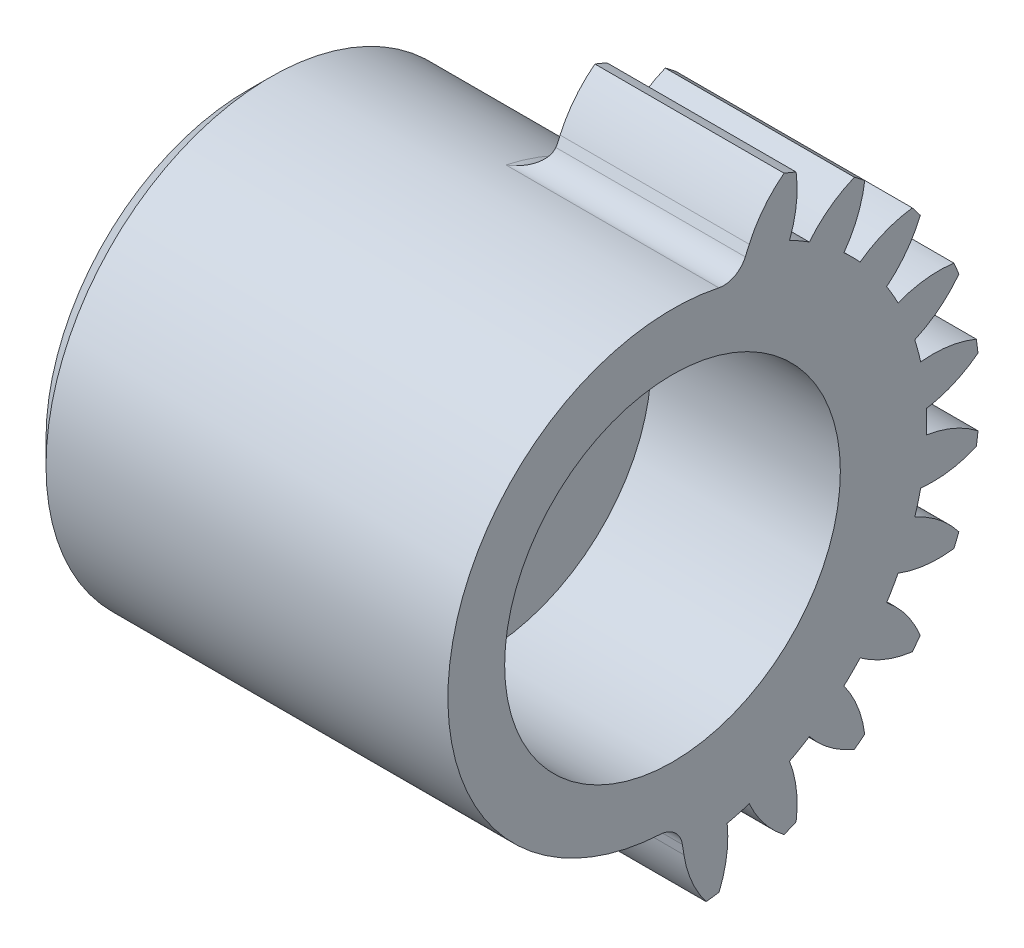
from build123d import *

# Parameters (mm, degrees)
BASPROSKE_W         = 8
BASPROSKE_H         = 13
TOOTHCUT_DEPTH      = 21.049937656
TEETHCUTS_COUNT     = 24
TEETHCUTS_ANGLE     = 345
BORSKE_R            = 2.5
BORE_DEPTH          = 50.0000508
SKETCH2_R           = 9.5
SKETCH2_R_2         = 7.1
SKETCH2_R_3         = 2.5
BOSS_EXTRUDE1_DEPTH = 10
CUT_EXTRUDE1_DEPTH  = 10
SKETCH2_4_R         = 7.1
SKETCH2_4_R_2       = 2.5
CUT_EXTRUDE2_DEPTH  = 21.83151436
FILLET1_R           = 1
CHAMFER1_SIZE       = 1


with BuildPart() as part:
    # BasProSke → Base-Revolve (revolve)
    with BuildSketch(Plane(origin=(0, 0, 0), x_dir=(1, 0, 0), z_dir=(0, 1, 0)), mode=Mode.PRIVATE) as base_revolve_sk:
        with Locations((4, 6.5)):
            Rectangle(BASPROSKE_W, BASPROSKE_H)
    revolve(base_revolve_sk.sketch.rotate(Axis((-10, 0, 0), (1, 0, 0)), 180), axis=Axis((-10, 0, 0), (1, 0, 0)))

    # TooCutSke → ToothCut (cut, through all)
    with BuildSketch(Plane(origin=(0, 0, 0), x_dir=(0, 0, -1), z_dir=(1, 0, 0))):
        with BuildLine():
            ThreePointArc((0.483448384, 10.738122679), (0, 10.749), (-0.483448384, 10.738122679))
            ThreePointArc((-0.483448384, 10.738122679), (-0.821636462, 11.902754369), (-1.44092227, 12.945454344))
            ThreePointArc((-1.44092227, 12.945454344), (0, 13.0254), (1.44092227, 12.945454344))
            ThreePointArc((1.44092227, 12.945454344), (0.821636462, 11.902754369), (0.483448384, 10.738122679))
        make_face()
    toothcut = extrude(amount=TOOTHCUT_DEPTH, mode=Mode.SUBTRACT)

    # TeethCuts: ToothCut ×24 about axis
    teethcuts_axis = Axis((-10, 0, 0), (1, 0, 0))
    for i in range(1, TEETHCUTS_COUNT):
        add(toothcut.rotate(teethcuts_axis, i * TEETHCUTS_ANGLE / (TEETHCUTS_COUNT - 1)), mode=Mode.SUBTRACT)

    # BorSke → Bore (cut, symmetric)
    with BuildSketch(Plane(origin=(0, 0, 0), x_dir=(0, 0, -1), z_dir=(1, 0, 0))):
        with Locations(Location((0, 0, 0), (0, 0, 180))):
            Circle(BORSKE_R)
    extrude(amount=BORE_DEPTH, both=True, mode=Mode.SUBTRACT)

    # Sketch2 → Boss-Extrude1 (add)
    # profile 1 of 2: a face of its own
    with BuildSketch(Plane.ZY):
        with Locations(Location((0, 0, 0), (0, 0, 180))):
            Circle(SKETCH2_R)
        Circle(SKETCH2_R_2, mode=Mode.SUBTRACT)
    # profile 2 of 2: a face of its own
    with BuildSketch(Plane.ZY):
        Circle(SKETCH2_R_2)
        Circle(SKETCH2_R_3, mode=Mode.SUBTRACT)
    extrude(amount=BOSS_EXTRUDE1_DEPTH)

    # Sketch2<3> → Cut-Extrude1 (cut)
    with BuildSketch(Plane.ZY):
        with BuildLine():
            ThreePointArc((-2.312255378, 10.49735567), (-2.782045916, 10.382736707), (-3.246205938, 10.247104372))
            Line((-3.246205938, 10.247104372), (-2.735935918, 9.097508156))
            ThreePointArc((-2.735935918, 9.097508156), (5.668271729, 7.623693043), (9.5, 0))
            ThreePointArc((9.5, 0), (6.614870502, -6.818613367), (-0.288102788, -9.495630405))
            Line((-0.288102788, -9.495630405), (-0.483448384, -10.738122679))
            ThreePointArc((-0.483448384, -10.738122679), (0, -10.749), (0.483448384, -10.738122679))
            ThreePointArc((0.483448384, -10.738122679), (0.815732219, -11.889084866), (1.422675204, -12.921919179))
            ThreePointArc((1.422675204, -12.921919179), (1.696840499, -12.888783198), (1.970240061, -12.849830898))
            ThreePointArc((1.970240061, -12.849830898), (2.289184775, -11.695101157), (2.312255378, -10.49735567))
            ThreePointArc((2.312255378, -10.49735567), (2.782045916, -10.382736707), (3.246205938, -10.247104372))
            ThreePointArc((3.246205938, -10.247104372), (3.86505841, -11.272847089), (4.718637505, -12.113400022))
            ThreePointArc((4.718637505, -12.113400022), (4.974884621, -12.010433923), (5.228886722, -11.902047876))
            ThreePointArc((5.228886722, -11.902047876), (5.238097609, -10.704115631), (4.950382757, -9.541211221))
            ThreePointArc((4.950382757, -9.541211221), (5.3745, -9.308907065), (5.787739922, -9.057762836))
            ThreePointArc((5.787739922, -9.057762836), (6.650987257, -9.888383413), (7.693032457, -10.479372673))
            ThreePointArc((7.693032457, -10.479372673), (7.913898577, -10.313593424), (8.131193393, -10.143159961))
            ThreePointArc((8.131193393, -10.143159961), (7.830042747, -8.983662315), (7.251149732, -7.934848994))
            ThreePointArc((7.251149732, -7.934848994), (7.600690791, -7.600690791), (7.934848994, -7.251149732))
            ThreePointArc((7.934848994, -7.251149732), (8.983662315, -7.830042747), (10.143159961, -8.131193393))
            ThreePointArc((10.143159961, -8.131193393), (10.313593424, -7.913898577), (10.479372673, -7.693032457))
            ThreePointArc((10.479372673, -7.693032457), (9.888383413, -6.650987257), (9.057762836, -5.787739922))
            ThreePointArc((9.057762836, -5.787739922), (9.308907065, -5.3745), (9.541211221, -4.950382757))
            ThreePointArc((9.541211221, -4.950382757), (10.704115631, -5.238097609), (11.902047876, -5.228886722))
            ThreePointArc((11.902047876, -5.228886722), (12.010433923, -4.974884621), (12.113400022, -4.718637505))
            ThreePointArc((12.113400022, -4.718637505), (11.272847089, -3.86505841), (10.247104372, -3.246205938))
            ThreePointArc((10.247104372, -3.246205938), (10.382736707, -2.782045916), (10.49735567, -2.312255378))
            ThreePointArc((10.49735567, -2.312255378), (11.695101157, -2.289184775), (12.849830898, -1.970240061))
            ThreePointArc((12.849830898, -1.970240061), (12.888783198, -1.696840499), (12.921919179, -1.422675204))
            ThreePointArc((12.921919179, -1.422675204), (11.889084866, -0.815732219), (10.738122679, -0.483448384))
            ThreePointArc((10.738122679, -0.483448384), (10.749, 0), (10.738122679, 0.483448384))
            ThreePointArc((10.738122679, 0.483448384), (11.889084866, 0.815732219), (12.921919179, 1.422675204))
            ThreePointArc((12.921919179, 1.422675204), (12.888783198, 1.696840499), (12.849830898, 1.970240061))
            ThreePointArc((12.849830898, 1.970240061), (11.695101157, 2.289184775), (10.49735567, 2.312255378))
            ThreePointArc((10.49735567, 2.312255378), (10.382736707, 2.782045916), (10.247104372, 3.246205938))
            ThreePointArc((10.247104372, 3.246205938), (11.272847089, 3.86505841), (12.113400022, 4.718637505))
            ThreePointArc((12.113400022, 4.718637505), (12.010433923, 4.974884621), (11.902047876, 5.228886722))
            ThreePointArc((11.902047876, 5.228886722), (10.704115631, 5.238097609), (9.541211221, 4.950382757))
            ThreePointArc((9.541211221, 4.950382757), (9.308907065, 5.3745), (9.057762836, 5.787739922))
            ThreePointArc((9.057762836, 5.787739922), (9.888383413, 6.650987257), (10.479372673, 7.693032457))
            ThreePointArc((10.479372673, 7.693032457), (10.313593424, 7.913898577), (10.143159961, 8.131193393))
            ThreePointArc((10.143159961, 8.131193393), (8.983662315, 7.830042747), (7.934848994, 7.251149732))
            ThreePointArc((7.934848994, 7.251149732), (7.600690791, 7.600690791), (7.251149732, 7.934848994))
            ThreePointArc((7.251149732, 7.934848994), (7.830042747, 8.983662315), (8.131193393, 10.143159961))
            ThreePointArc((8.131193393, 10.143159961), (7.913898577, 10.313593424), (7.693032457, 10.479372673))
            ThreePointArc((7.693032457, 10.479372673), (6.650987257, 9.888383413), (5.787739922, 9.057762836))
            ThreePointArc((5.787739922, 9.057762836), (5.3745, 9.308907065), (4.950382757, 9.541211221))
            ThreePointArc((4.950382757, 9.541211221), (5.238097609, 10.704115631), (5.228886722, 11.902047876))
            ThreePointArc((5.228886722, 11.902047876), (4.974884621, 12.010433923), (4.718637505, 12.113400022))
            ThreePointArc((4.718637505, 12.113400022), (3.86505841, 11.272847089), (3.246205938, 10.247104372))
            ThreePointArc((3.246205938, 10.247104372), (2.782045916, 10.382736707), (2.312255378, 10.49735567))
            ThreePointArc((2.312255378, 10.49735567), (2.289184775, 11.695101157), (1.970240061, 12.849830898))
            ThreePointArc((1.970240061, 12.849830898), (1.696840499, 12.888783198), (1.422675204, 12.921919179))
            ThreePointArc((1.422675204, 12.921919179), (0.815732219, 11.889084866), (0.483448384, 10.738122679))
            ThreePointArc((0.483448384, 10.738122679), (0, 10.749), (-0.483448384, 10.738122679))
            ThreePointArc((-0.483448384, 10.738122679), (-0.815732219, 11.889084866), (-1.422675204, 12.921919179))
            ThreePointArc((-1.422675204, 12.921919179), (-1.696840499, 12.888783198), (-1.970240061, 12.849830898))
            ThreePointArc((-1.970240061, 12.849830898), (-2.289184775, 11.695101157), (-2.312255378, 10.49735567))
        make_face()
    extrude(amount=-CUT_EXTRUDE1_DEPTH, mode=Mode.SUBTRACT)

    # Sketch2<4> → Cut-Extrude2 (cut, through all)
    with BuildSketch(Plane.ZY):
        Circle(SKETCH2_4_R)
        Circle(SKETCH2_4_R_2, mode=Mode.SUBTRACT)
    extrude(amount=-CUT_EXTRUDE2_DEPTH, mode=Mode.SUBTRACT)

    # Fillet1
    # the kernel refuses this fillet: 1 mm, written as the material it adds along each edge
    with BuildSketch(Plane(origin=(0, 0, 0), x_dir=(0, 0, -1), z_dir=(0, 1, 0))) as fillet1_piece_1_section:
        with BuildLine():
            CenterArc((9.5 + FILLET1_R, FILLET1_R), FILLET1_R, 180, 90)
            Line((9.5, FILLET1_R), (9.5, 0))
            Line((9.5, 0), (9.5 + FILLET1_R, 0))
        make_face()
    fillet1_piece_1 = revolve(axis=Axis((0, 0, 0), (-1, 0, 0)), revolution_arc=103.345808715, mode=Mode.PRIVATE)
    fillet1_piece_1 = split(fillet1_piece_1, bisect_by=Plane(origin=(-0.281845865, -7.908879118, -0.038632524), z_dir=(0, 0.15531294924134567, -0.9878653186532844)), keep=Keep.TOP, mode=Mode.PRIVATE)
    add(fillet1_piece_1)
    with BuildSketch(Plane(origin=(0, -9.495630405, -0.288102788), x_dir=(0, -0.9878653186532845, -0.15531294924134548), z_dir=(1, 0, 0))) as fillet1_piece_2:
        with BuildLine():
            CenterArc((0.843884873, -1), FILLET1_R, 90, 77.960305795)
            ThreePointArc((-0.134118453, -0.791410704), (-0.058696795, -0.397122513), (0, 0))
            Line((0, 0), (0.843884873, 0))
        make_face()
    extrude(amount=8)
    with BuildSketch(Plane(origin=(0, 9.097508156, -2.735935918), x_dir=(0, 0.9140066749677942, -0.4056991472930614), z_dir=(1, 0, 0))) as fillet1_piece_3:
        with BuildLine():
            CenterArc((0.843884873, 1), FILLET1_R, 192.039694205, 77.960305795)
            ThreePointArc((-0.134118453, 0.791410704), (-0.058696795, 0.397122513), (0, 0))
            Line((0, 0), (0.843884873, 0))
        make_face()
    extrude(amount=8)
    with BuildSketch(Plane(origin=(0, 0, 0), x_dir=(0, 0.9995823457354229, -0.028898686718770317), z_dir=(0, 0.028898686718770317, 0.9995823457354229))) as fillet1_piece_4_section:
        with BuildLine():
            CenterArc((9.5 + FILLET1_R, FILLET1_R), FILLET1_R, 180, 90)
            Line((9.5, FILLET1_R), (9.5, 0))
            Line((9.5, 0), (9.5 + FILLET1_R, 0))
        make_face()
    fillet1_piece_4 = revolve(axis=Axis((0, 0, 0), (-1, 0, 0)), revolution_arc=88.343996666, mode=Mode.PRIVATE)
    fillet1_piece_4 = split(fillet1_piece_4, bisect_by=Plane(origin=(-0.282512294, 8.270021566, -2.368640346), z_dir=(0, -0.4056991472930615, -0.9140066749677941)), keep=Keep.TOP, mode=Mode.PRIVATE)
    add(fillet1_piece_4)
    with BuildSketch(Plane(origin=(0, 0, 0), x_dir=(0, 0, -1), z_dir=(0, 1, 0))) as fillet1_piece_5a_section:
        with BuildLine():
            CenterArc((9.5 + FILLET1_R, FILLET1_R), FILLET1_R, 180, 90)
            Line((9.5, FILLET1_R), (9.5, 0))
            Line((9.5, 0), (9.5 + FILLET1_R, 0))
        make_face()
    fillet1_piece_5a = revolve(axis=Axis((0, 0, 0), (-1, 0, 0)), revolution_arc=103.345808715, mode=Mode.PRIVATE)
    fillet1_piece_5a = split(fillet1_piece_5a, bisect_by=Plane(origin=(-0.222264808, -9.459956662, -0.282494135), z_dir=(0, -0.15531294924134567, 0.9878653186532844)), keep=Keep.TOP, mode=Mode.PRIVATE)
    with BuildSketch(Plane(origin=(-2.109712182, -9.495630405, -0.288102788), x_dir=(0, -0.9878653186532844, -0.15531294924134598), z_dir=(1, 0, 0))) as fillet1_piece_5b_section:
        with BuildLine():
            CenterArc((0.843884873, -1), FILLET1_R, 90, 77.960305795)
            ThreePointArc((-0.134118453, -0.791410704), (-0.058696795, -0.397122513), (0, 0))
            Line((0, 0), (0.843884873, 0))
        make_face()
    fillet1_piece_5b = extrude(amount=10.109712182, mode=Mode.PRIVATE)
    fillet1_piece_5b = split(fillet1_piece_5b, bisect_by=Plane(origin=(0, -9.685689477, -0.139811966), z_dir=(-1, 0, 0)), keep=Keep.TOP, mode=Mode.PRIVATE)
    fillet1_piece_5 = fillet1_piece_5a & fillet1_piece_5b
    add(fillet1_piece_5)
    with BuildSketch(Plane(origin=(0, 0, 0), x_dir=(0, 0.9995823457354229, -0.028898686718770317), z_dir=(0, 0.028898686718770317, 0.9995823457354229))) as fillet1_piece_6a_section:
        with BuildLine():
            CenterArc((9.5 + FILLET1_R, FILLET1_R), FILLET1_R, 180, 90)
            Line((9.5, FILLET1_R), (9.5, 0))
            Line((9.5, 0), (9.5 + FILLET1_R, 0))
        make_face()
    fillet1_piece_6a = revolve(axis=Axis((0, 0, 0), (-1, 0, 0)), revolution_arc=88.343996666, mode=Mode.PRIVATE)
    fillet1_piece_6a = split(fillet1_piece_6a, bisect_by=Plane(origin=(-0.222264609, 9.064543487, -2.721303926), z_dir=(0, 0.4056991472930615, 0.9140066749677941)), keep=Keep.TOP, mode=Mode.PRIVATE)
    with BuildSketch(Plane(origin=(-2.109712182, 9.097508156, -2.735935918), x_dir=(0, 0.9140066749677942, -0.4056991472930614), z_dir=(1, 0, 0))) as fillet1_piece_6b_section:
        with BuildLine():
            CenterArc((0.843884873, 1), FILLET1_R, 192.039694205, 77.960305795)
            ThreePointArc((-0.134118453, 0.791410704), (-0.058696795, 0.397122513), (0, 0))
            Line((0, 0), (0.843884873, 0))
        make_face()
    fillet1_piece_6b = extrude(amount=10.109712182, mode=Mode.PRIVATE)
    fillet1_piece_6b = split(fillet1_piece_6b, bisect_by=Plane(origin=(0, 9.319471612, -2.641888891), z_dir=(-1, 0, 0)), keep=Keep.TOP, mode=Mode.PRIVATE)
    fillet1_piece_6 = fillet1_piece_6a & fillet1_piece_6b
    add(fillet1_piece_6)

    # Chamfer1
    chamfer1_edges = [part.edges().sort_by_distance(p)[0] for p in [
        (-10, 0, -2.5),
        (-10, 0, 9.5),
    ]]
    chamfer(chamfer1_edges, length=CHAMFER1_SIZE)


solid = part.part
